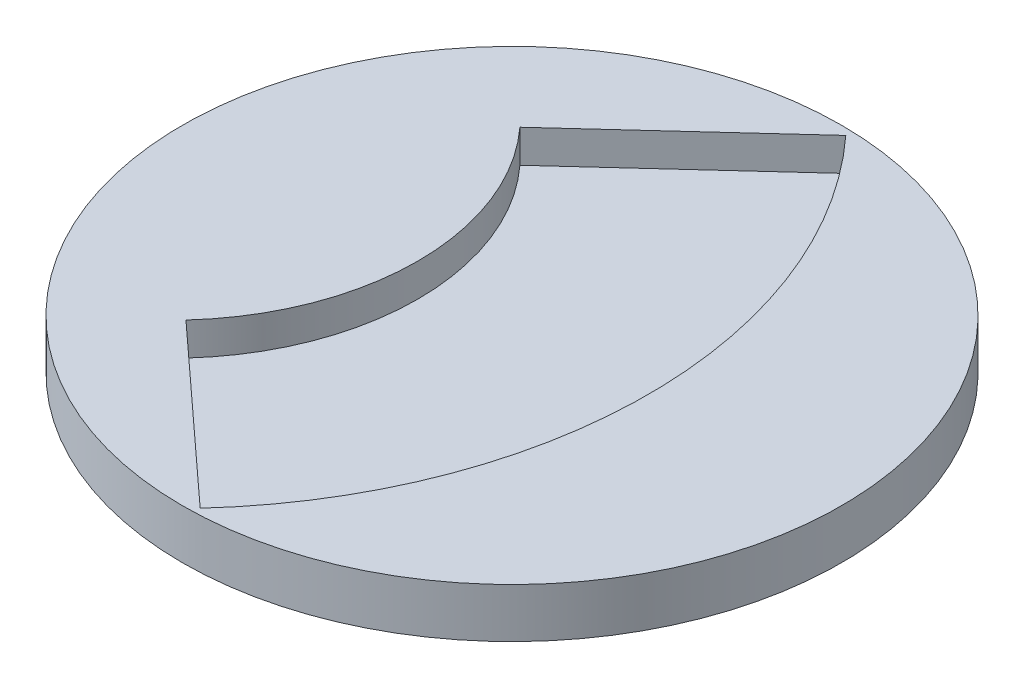
from build123d import *

# Parameters (mm, degrees)
CUT_EXTRUDE1_DEPTH = 2


with BuildPart() as part:
    # Sketch1 → Revolve1 (revolve)
    with BuildSketch(Plane.XY):
        Polygon((1.05, -2), (1.05, 2), (0, 2), (0, 5), (20, 5), (20, 2), (3.05, 2), (3.05, -2), align=None)
    revolve(axis=Axis((0, -3.539189189, 0), (0, 1, 0)))

    # Sketch2 → Cut-Extrude1 (cut)
    with BuildSketch(Plane(origin=(0, 5, 0), x_dir=(1, 0, 0), z_dir=(0, 1, 0))):
        with BuildLine():
            Line((0.667527676, 19.592116021), (-9.65435504, 10.133853114))
            ThreePointArc((-9.65435504, 10.133853114), (-5.713515092, 0), (-9.65435504, -10.133853114))
            Line((-9.65435504, -10.133853114), (0.667527676, -19.592116021))
            ThreePointArc((0.667527676, -19.592116021), (8.286484908, 0), (0.667527676, 19.592116021))
        make_face()
    extrude(amount=-CUT_EXTRUDE1_DEPTH, mode=Mode.SUBTRACT)


solid = part.part
